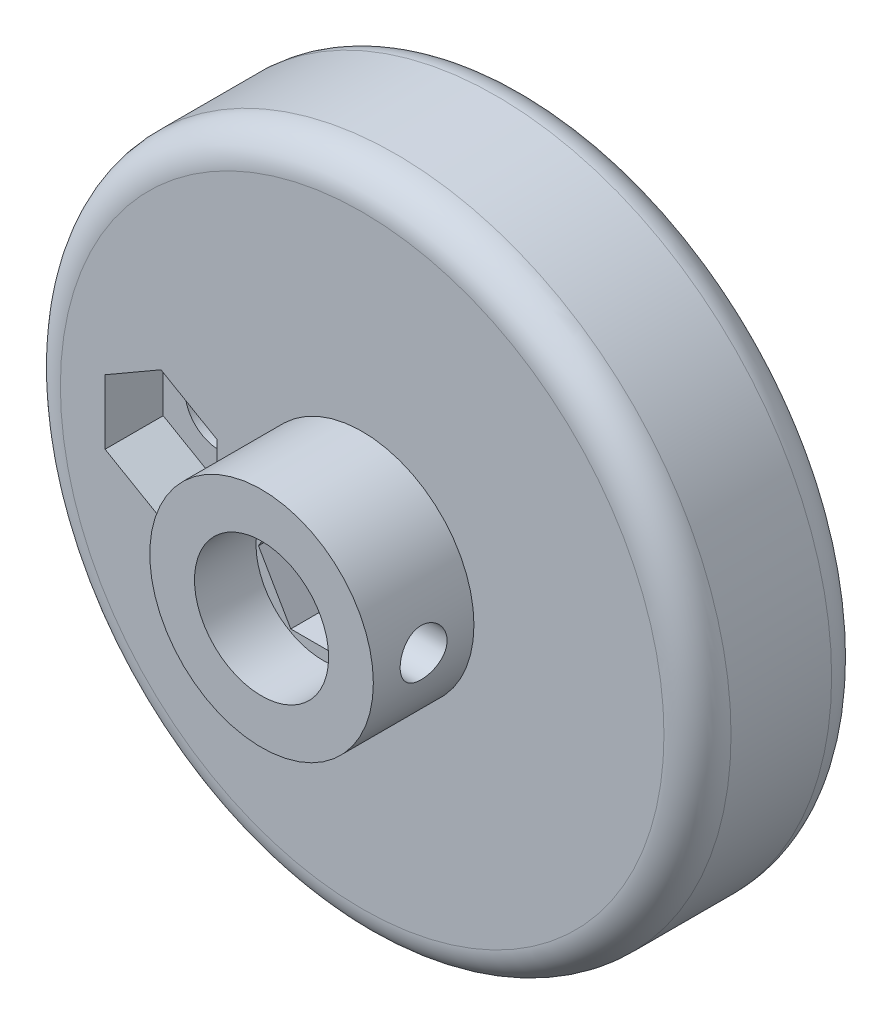
from build123d import *

# Parameters (mm, degrees)
SKETCH1_R           = 30
BOSS_EXTRUDE1_DEPTH = 15
SKETCH2_R           = 10
BOSS_EXTRUDE2_DEPTH = 9
SKETCH3_R           = 3.175
CUT_EXTRUDE1_DEPTH  = 49.744230428
FILLET1_R           = 3
SKETCH4_R           = 6
CUT_EXTRUDE2_DEPTH  = 4
FILLET2_R           = 1
SKETCH5_W           = 2.1
SKETCH5_H           = 30
SKETCH8_R           = 3.05
CUT_EXTRUDE3_DEPTH  = 46.000000067
CUT_EXTRUDE4_DEPTH  = 5.2
CUT_EXTRUDE5_START  = -5.5
SKETCH9_R           = 6
CUT_EXTRUDE5_DEPTH  = 5.5
CUT_EXTRUDE6_DEPTH  = 5.5


with BuildPart() as part:
    # Sketch1 → Boss-Extrude1 (new body)
    with BuildSketch(Plane.XY):
        Circle(SKETCH1_R)
    extrude(amount=BOSS_EXTRUDE1_DEPTH)

    # Sketch2 → Boss-Extrude2 (add)
    with BuildSketch(Plane.XY.offset(15)):
        Circle(SKETCH2_R)
    extrude(amount=BOSS_EXTRUDE2_DEPTH)

    # Sketch3 → Cut-Extrude1 (cut, through all)
    with BuildSketch(Plane.XY.offset(24)):
        Circle(SKETCH3_R)
    extrude(amount=-CUT_EXTRUDE1_DEPTH, mode=Mode.SUBTRACT)

    # Fillet1
    fillet1_edges = [part.edges().sort_by_distance(p)[0] for p in [
        (-30, 0, 0),
        (-30, 0, 15),
    ]]
    fillet(fillet1_edges, radius=FILLET1_R)

    # Sketch4 → Cut-Extrude2 (cut)
    with BuildSketch(Plane(origin=(0, 0, 0), x_dir=(-1, 0, 0), z_dir=(0, 0, -1))):
        Circle(SKETCH4_R)
    extrude(amount=-CUT_EXTRUDE2_DEPTH, mode=Mode.SUBTRACT)

    # Fillet2
    fillet2_edges = [part.edges().sort_by_distance(p)[0] for p in [
        (6, 0, 0),
    ]]
    fillet(fillet2_edges, radius=FILLET2_R)

    # Sketch5 → M5x0.8 Tapped Hole1 (revolve, cut)
    with BuildSketch(Plane(origin=(0, 0, 19.5), x_dir=(0, 0, 1), z_dir=(0, 1, 0))):
        with Locations((1.05, 15)):
            Rectangle(SKETCH5_W, SKETCH5_H)
    revolve(axis=Axis((-6.35, 0, 19.5), (1, 0, 0)), mode=Mode.SUBTRACT)

    # Sketch8 → Cut-Extrude3 (cut, through all)
    with BuildSketch(Plane.XY.offset(15)):
        with Locations((-18, 0)):
            Circle(SKETCH8_R)
    extrude(amount=-CUT_EXTRUDE3_DEPTH, mode=Mode.SUBTRACT)

    # Sketch7 → Cut-Extrude4 (cut)
    with BuildSketch(Plane.XY.offset(15)):
        Polygon((-23, 2.886751346), (-23, -2.886751346), (-18, -5.773502692), (-13, -2.886751346), (-13, 2.886751346), (-18, 5.773502692), align=None)
    extrude(amount=-CUT_EXTRUDE4_DEPTH, mode=Mode.SUBTRACT)

    # Sketch9 → Cut-Extrude5 (cut)
    with BuildSketch(Plane.XY.offset(24).offset(CUT_EXTRUDE5_START)):
        Circle(SKETCH9_R)
    extrude(amount=CUT_EXTRUDE5_DEPTH, mode=Mode.SUBTRACT)

    # Sketch10 → Cut-Extrude6 (cut)
    with BuildSketch(Plane.XY.offset(18.5)):
        Polygon((5.773502692, 0), (2.886751346, 5), (-2.886751346, 5), (-5.773502692, 0), (-2.886751346, -5), (2.886751346, -5), align=None)
    extrude(amount=-CUT_EXTRUDE6_DEPTH, mode=Mode.SUBTRACT)


solid = part.part
